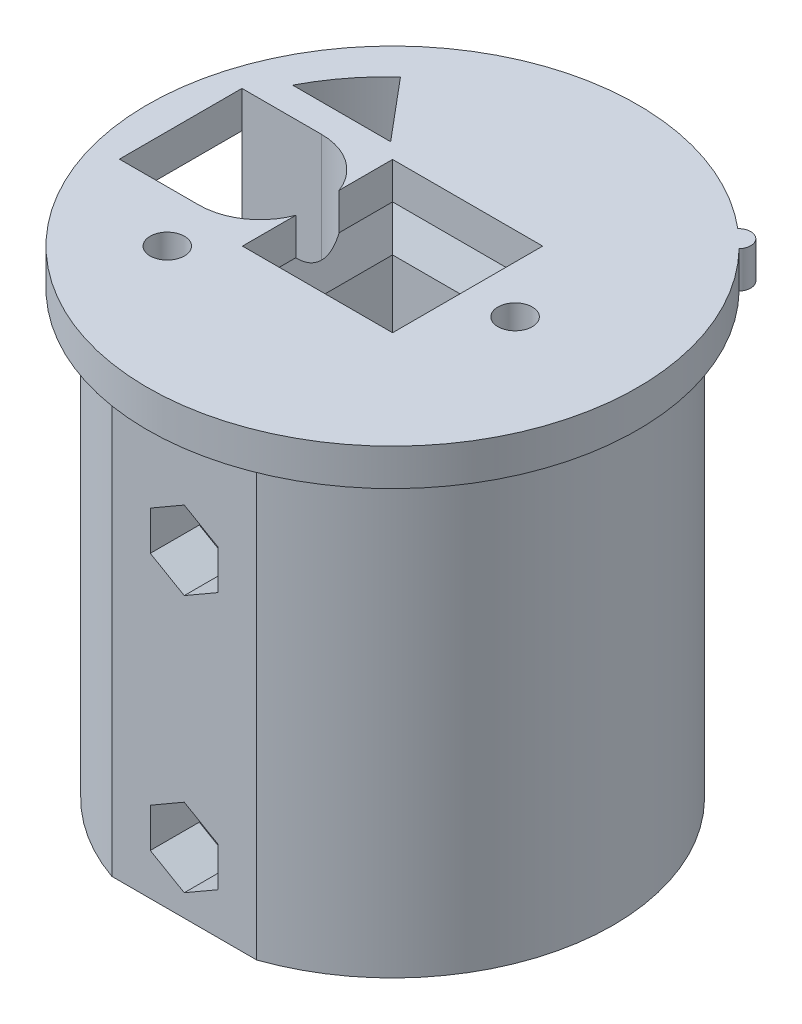
from build123d import *

# Parameters (mm, degrees)
SKETCH1_R           = 18
SKETCH1_R_2         = 2
SKETCH1_W           = 10.25
SKETCH1_H           = 10.25
BOSS_EXTRUDE1_DEPTH = 36
CUT_EXTRUDE1_START  = -7
CUT_EXTRUDE1_DEPTH  = 7
SKETCH4_W           = 9.35
SKETCH4_H           = 9.35
CUT_EXTRUDE3_DEPTH  = 20.4
CUT_EXTRUDE4_START  = -40
CUT_EXTRUDE4_DEPTH  = 40
SKETCH6_R           = 1.5
CUT_EXTRUDE5_DEPTH  = 53.687759489
SKETCH7_R           = 3
CUT_EXTRUDE6_DEPTH  = 3
CUT_EXTRUDE7_DEPTH  = 4
CHAMFER1_SIZE       = 1
CHAMFER1_SIZE_2     = 2.747477419
CUT_EXTRUDE8_DEPTH  = 44.69210455
SKETCH12_R          = 1.4
CUT_EXTRUDE10_DEPTH = 20
SKETCH13_R          = 20
SKETCH13_R_2        = 1.4
BOSS_EXTRUDE2_DEPTH = 3
BOSS_EXTRUDE3_DEPTH = 3


with BuildPart() as part:
    # Sketch1 → Boss-Extrude1 (new body)
    with BuildSketch(Plane(origin=(0, 0, 0), x_dir=(1, 0, 0), z_dir=(0, 1, 0))):
        with Locations(Location((0, 0, 0), (0, 0, 270))):
            Circle(SKETCH1_R)
        with Locations(Location((-12, 0, 0), (0, 0, 270))):
            Circle(SKETCH1_R_2, mode=Mode.SUBTRACT)
        Rectangle(SKETCH1_W, SKETCH1_H, mode=Mode.SUBTRACT)
    extrude(amount=BOSS_EXTRUDE1_DEPTH)

    # Sketch2 → Cut-Extrude1 (cut)
    with BuildSketch(Plane(origin=(0, 36, 0), x_dir=(1, 0, 0), z_dir=(0, 1, 0)).offset(CUT_EXTRUDE1_START)):
        with BuildLine():
            Line((-10.8, 5), (-17.291616466, 5))
            ThreePointArc((-17.291616466, 5), (-18, 0), (-17.291616466, -5))
            Line((-17.291616466, -5), (-10.8, -5))
            ThreePointArc((-10.8, -5), (-5.8, 0), (-10.8, 5))
        make_face()
    extrude(amount=CUT_EXTRUDE1_DEPTH, mode=Mode.SUBTRACT)

    # Sketch4 → Cut-Extrude3 (cut)
    with BuildSketch(Plane(origin=(0, 0, 0), x_dir=(-1, 0, 0), z_dir=(0, -1, 0))):
        with Locations((11.135393506, 0.872889968)):
            Rectangle(SKETCH4_W, SKETCH4_H)
    extrude(amount=-CUT_EXTRUDE3_DEPTH, mode=Mode.SUBTRACT)

    # Sketch5 → Cut-Extrude4 (cut)
    with BuildSketch(Plane(origin=(0, 36, 0), x_dir=(1, 0, 0), z_dir=(0, 1, 0)).offset(CUT_EXTRUDE4_START)):
        with BuildLine():
            Line((5.916079783, 17), (-5.916079783, 17))
            ThreePointArc((-5.916079783, 17), (0, 18), (5.916079783, 17))
        make_face()
        with BuildLine():
            Line((5.916079783, -17), (-5.916079783, -17))
            ThreePointArc((-5.916079783, -17), (0, -18), (5.916079783, -17))
        make_face()
    extrude(amount=CUT_EXTRUDE4_DEPTH, mode=Mode.SUBTRACT)

    # Sketch6 → Cut-Extrude5 (cut, through all)
    with BuildSketch(Plane(origin=(0, 0, -17), x_dir=(-1, 0, 0), z_dir=(0, 0, -1))):
        with Locations((0, 26)):
            Circle(SKETCH6_R)
        with Locations((0, 5)):
            Circle(SKETCH6_R)
    extrude(amount=-CUT_EXTRUDE5_DEPTH, mode=Mode.SUBTRACT)

    # Sketch7 → Cut-Extrude6 (cut)
    with BuildSketch(Plane(origin=(0, 0, -17), x_dir=(-1, 0, 0), z_dir=(0, 0, -1))):
        with Locations((0, 26)):
            Circle(SKETCH7_R)
        with Locations((0, 5)):
            Circle(SKETCH7_R)
    extrude(amount=-CUT_EXTRUDE6_DEPTH, mode=Mode.SUBTRACT)

    # Sketch8 → Cut-Extrude7 (cut)
    with BuildSketch(Plane.XY.offset(17)):
        Polygon((0, 22.8), (2.771281292, 24.4), (2.771281292, 27.6), (0, 29.2), (-2.771281292, 27.6), (-2.771281292, 24.4), align=None)
        Polygon((0, 1.8), (2.771281292, 3.4), (2.771281292, 6.6), (0, 8.2), (-2.771281292, 6.6), (-2.771281292, 3.4), align=None)
    extrude(amount=-CUT_EXTRUDE7_DEPTH, mode=Mode.SUBTRACT)

    # Chamfer1
    # the kernel refuses this chamfer: 2.747477419, 1 mm, written as the material it takes off along each edge
    with BuildSketch(Plane(origin=(-5.125, 36, -5.125), x_dir=(0, 0.09904090225204956, -0.9950833631817488), z_dir=(1, 0, 0)), Plane(origin=(-5.125, 36, 5.125), x_dir=(-0.9950833631817488, 0.09904090225204956, 0), z_dir=(0, 0, -1)), Plane(origin=(5.125, 36, 5.125), x_dir=(0, 0.09904090225204956, 0.9950833631817488), z_dir=(-1, 0, 0)), Plane(origin=(5.125, 36, -5.125), x_dir=(0.9950833631817488, 0.09904090225204956, 0), z_dir=(0, 0, 1))) as chamfer1_piece_1:
        Polygon((CHAMFER1_SIZE * 0.995083363182, -CHAMFER1_SIZE * 0.099040902252), (-CHAMFER1_SIZE_2 * 0.0990409022684, -CHAMFER1_SIZE_2 * 0.995083363346), (0, 0), align=None)
    extrude(amount=10.25, mode=Mode.SUBTRACT)
    with BuildSketch(Plane(origin=(-5.125, 36, 5.125), x_dir=(-0.9950833631817488, 0.09904090225204956, 0), z_dir=(0, 0, -1))) as chamfer1_piece_2a_section:
        Polygon((CHAMFER1_SIZE * 0.995083363182, -CHAMFER1_SIZE * 0.099040902252), (-CHAMFER1_SIZE_2 * 0.0990409022684, -CHAMFER1_SIZE_2 * 0.995083363346), (0, 0), align=None)
    chamfer1_piece_2a = extrude(amount=17.377491449, mode=Mode.PRIVATE)
    chamfer1_piece_2a = split(chamfer1_piece_2a, bisect_by=Plane(origin=(-5.432505006, 35.059901151, -5.125), z_dir=(0, 0, -1)), keep=Keep.TOP, mode=Mode.PRIVATE)
    with BuildSketch(Plane(origin=(-12.252491449, 36, -5.125), x_dir=(0, 0.09904090225204956, -0.9950833631817488), z_dir=(1, 0, 0))) as chamfer1_piece_2b_section:
        Polygon((CHAMFER1_SIZE * 0.995083363182, -CHAMFER1_SIZE * 0.099040902252), (-CHAMFER1_SIZE_2 * 0.0990409022684, -CHAMFER1_SIZE_2 * 0.995083363346), (0, 0), align=None)
    chamfer1_piece_2b = extrude(amount=17.377491449, mode=Mode.PRIVATE)
    chamfer1_piece_2b = split(chamfer1_piece_2b, bisect_by=Plane(origin=(-5.125, 35.059901151, -5.432505006), z_dir=(-1, 0, 0)), keep=Keep.TOP, mode=Mode.PRIVATE)
    chamfer1_piece_2 = chamfer1_piece_2a & chamfer1_piece_2b
    add(chamfer1_piece_2, mode=Mode.SUBTRACT)
    with BuildSketch(Plane(origin=(5.125, 36, -12.252491449), x_dir=(0.9950833631817488, 0.09904090225204956, 0), z_dir=(0, 0, 1))) as chamfer1_piece_3a_section:
        Polygon((CHAMFER1_SIZE * 0.995083363182, -CHAMFER1_SIZE * 0.099040902252), (-CHAMFER1_SIZE_2 * 0.0990409022684, -CHAMFER1_SIZE_2 * 0.995083363346), (0, 0), align=None)
    chamfer1_piece_3a = extrude(amount=17.377491449, mode=Mode.PRIVATE)
    chamfer1_piece_3a = split(chamfer1_piece_3a, bisect_by=Plane(origin=(5.432505006, 35.059901151, -5.125), z_dir=(0, 0, -1)), keep=Keep.TOP, mode=Mode.PRIVATE)
    with BuildSketch(Plane(origin=(-5.125, 36, -5.125), x_dir=(0, 0.09904090225204956, -0.9950833631817488), z_dir=(1, 0, 0))) as chamfer1_piece_3b_section:
        Polygon((CHAMFER1_SIZE * 0.995083363182, -CHAMFER1_SIZE * 0.099040902252), (-CHAMFER1_SIZE_2 * 0.0990409022684, -CHAMFER1_SIZE_2 * 0.995083363346), (0, 0), align=None)
    chamfer1_piece_3b = extrude(amount=17.377491449, mode=Mode.PRIVATE)
    chamfer1_piece_3b = split(chamfer1_piece_3b, bisect_by=Plane(origin=(5.125, 35.059901151, -5.432505006), z_dir=(1, 0, 0)), keep=Keep.TOP, mode=Mode.PRIVATE)
    chamfer1_piece_3 = chamfer1_piece_3a & chamfer1_piece_3b
    add(chamfer1_piece_3, mode=Mode.SUBTRACT)
    with BuildSketch(Plane(origin=(5.125, 36, 5.125), x_dir=(0, 0.09904090225204956, 0.9950833631817488), z_dir=(-1, 0, 0))) as chamfer1_piece_4a_section:
        Polygon((CHAMFER1_SIZE * 0.995083363182, -CHAMFER1_SIZE * 0.099040902252), (-CHAMFER1_SIZE_2 * 0.0990409022684, -CHAMFER1_SIZE_2 * 0.995083363346), (0, 0), align=None)
    chamfer1_piece_4a = extrude(amount=17.377491449, mode=Mode.PRIVATE)
    chamfer1_piece_4a = split(chamfer1_piece_4a, bisect_by=Plane(origin=(-5.125, 35.059901151, 5.432505006), z_dir=(-1, 0, 0)), keep=Keep.TOP, mode=Mode.PRIVATE)
    with BuildSketch(Plane(origin=(-5.125, 36, 12.252491449), x_dir=(-0.9950833631817488, 0.09904090225204956, 0), z_dir=(0, 0, -1))) as chamfer1_piece_4b_section:
        Polygon((CHAMFER1_SIZE * 0.995083363182, -CHAMFER1_SIZE * 0.099040902252), (-CHAMFER1_SIZE_2 * 0.0990409022684, -CHAMFER1_SIZE_2 * 0.995083363346), (0, 0), align=None)
    chamfer1_piece_4b = extrude(amount=17.377491449, mode=Mode.PRIVATE)
    chamfer1_piece_4b = split(chamfer1_piece_4b, bisect_by=Plane(origin=(-5.432505006, 35.059901151, 5.125), z_dir=(0, 0, 1)), keep=Keep.TOP, mode=Mode.PRIVATE)
    chamfer1_piece_4 = chamfer1_piece_4a & chamfer1_piece_4b
    add(chamfer1_piece_4, mode=Mode.SUBTRACT)
    with BuildSketch(Plane(origin=(12.252491449, 36, 5.125), x_dir=(0, 0.09904090225204956, 0.9950833631817488), z_dir=(-1, 0, 0))) as chamfer1_piece_5a_section:
        Polygon((CHAMFER1_SIZE * 0.995083363182, -CHAMFER1_SIZE * 0.099040902252), (-CHAMFER1_SIZE_2 * 0.0990409022684, -CHAMFER1_SIZE_2 * 0.995083363346), (0, 0), align=None)
    chamfer1_piece_5a = extrude(amount=17.377491449, mode=Mode.PRIVATE)
    chamfer1_piece_5a = split(chamfer1_piece_5a, bisect_by=Plane(origin=(5.125, 35.059901151, 5.432505006), z_dir=(1, 0, 0)), keep=Keep.TOP, mode=Mode.PRIVATE)
    with BuildSketch(Plane(origin=(5.125, 36, -5.125), x_dir=(0.9950833631817488, 0.09904090225204956, 0), z_dir=(0, 0, 1))) as chamfer1_piece_5b_section:
        Polygon((CHAMFER1_SIZE * 0.995083363182, -CHAMFER1_SIZE * 0.099040902252), (-CHAMFER1_SIZE_2 * 0.0990409022684, -CHAMFER1_SIZE_2 * 0.995083363346), (0, 0), align=None)
    chamfer1_piece_5b = extrude(amount=17.377491449, mode=Mode.PRIVATE)
    chamfer1_piece_5b = split(chamfer1_piece_5b, bisect_by=Plane(origin=(5.432505006, 35.059901151, 5.125), z_dir=(0, 0, 1)), keep=Keep.TOP, mode=Mode.PRIVATE)
    chamfer1_piece_5 = chamfer1_piece_5a & chamfer1_piece_5b
    add(chamfer1_piece_5, mode=Mode.SUBTRACT)

    # Sketch9 → Cut-Extrude8 (cut, through all)
    with BuildSketch(Plane.XZ):
        with BuildLine():
            Line((-7.454203172, -7.297889968), (-15.454203172, -7.297889968))
            ThreePointArc((-15.454203172, -7.297889968), (-13.761984914, -9.955415688), (-11.632322635, -12.277178848))
            Line((-11.632322635, -12.277178848), (-7.454203172, -7.297889968))
        make_face()
    extrude(amount=-CUT_EXTRUDE8_DEPTH, mode=Mode.SUBTRACT)

    # Sketch12 → Cut-Extrude10 (cut)
    with BuildSketch(Plane(origin=(0, 36, 0), x_dir=(1, 0, 0), z_dir=(0, 1, 0))):
        with Locations(Location((10, 0, 0), (0, 0, 270))):
            Circle(SKETCH12_R)
        with Locations(Location((-9.192388155, -9.192388155, 0), (0, 0, 270))):
            Circle(SKETCH12_R)
    extrude(amount=-CUT_EXTRUDE10_DEPTH, mode=Mode.SUBTRACT)

    # Sketch13 → Boss-Extrude2 (add)
    with BuildSketch(Plane(origin=(0, 36, 0), x_dir=(1, 0, 0), z_dir=(0, 1, 0))):
        with Locations(Location((0, 0, 0), (0, 0, 270))):
            Circle(SKETCH13_R)
        with Locations(Location((10, 0, 0), (0, 0, 270))):
            Circle(SKETCH13_R_2, mode=Mode.SUBTRACT)
        with Locations(Location((-9.192388155, -9.192388155, 0), (0, 0, 270))):
            Circle(SKETCH13_R_2, mode=Mode.SUBTRACT)
        with BuildLine():
            Line((-10.8, 5), (-17.291616466, 5))
            Line((-17.291616466, 5), (-17.291616466, -5))
            Line((-17.291616466, -5), (-10.8, -5))
            ThreePointArc((-10.8, -5), (-7.959770503, -4.114984375), (-6.125, -1.773238563))
            Line((-6.125, -1.773238563), (-6.125, -6.125))
            Line((-6.125, -6.125), (6.125, -6.125))
            Line((6.125, -6.125), (6.125, 6.125))
            Line((6.125, 6.125), (-6.125, 6.125))
            Line((-6.125, 6.125), (-6.125, 1.773238563))
            ThreePointArc((-6.125, 1.773238563), (-7.959770503, 4.114984375), (-10.8, 5))
        make_face(mode=Mode.SUBTRACT)
        with BuildLine():
            Line((-7.454203172, 7.297889968), (-15.454203172, 7.297889968))
            ThreePointArc((-15.454203172, 7.297889968), (-13.761984914, 9.955415688), (-11.632322635, 12.277178848))
            Line((-11.632322635, 12.277178848), (-7.454203172, 7.297889968))
        make_face(mode=Mode.SUBTRACT)
    extrude(amount=BOSS_EXTRUDE2_DEPTH)

    # Sketch14 → Boss-Extrude3 (add)
    with BuildSketch(Plane(origin=(0, 39, 0), x_dir=(1, 0, 0), z_dir=(0, 1, 0))):
        with BuildLine():
            Line((12.855752194, 15.320888862), (14.321646009, 13.960317173))
            ThreePointArc((14.321646009, 13.960317173), (14.268984946, 15.373549926), (12.855752194, 15.320888862))
        make_face()
    extrude(amount=-BOSS_EXTRUDE3_DEPTH)


solid = part.part
